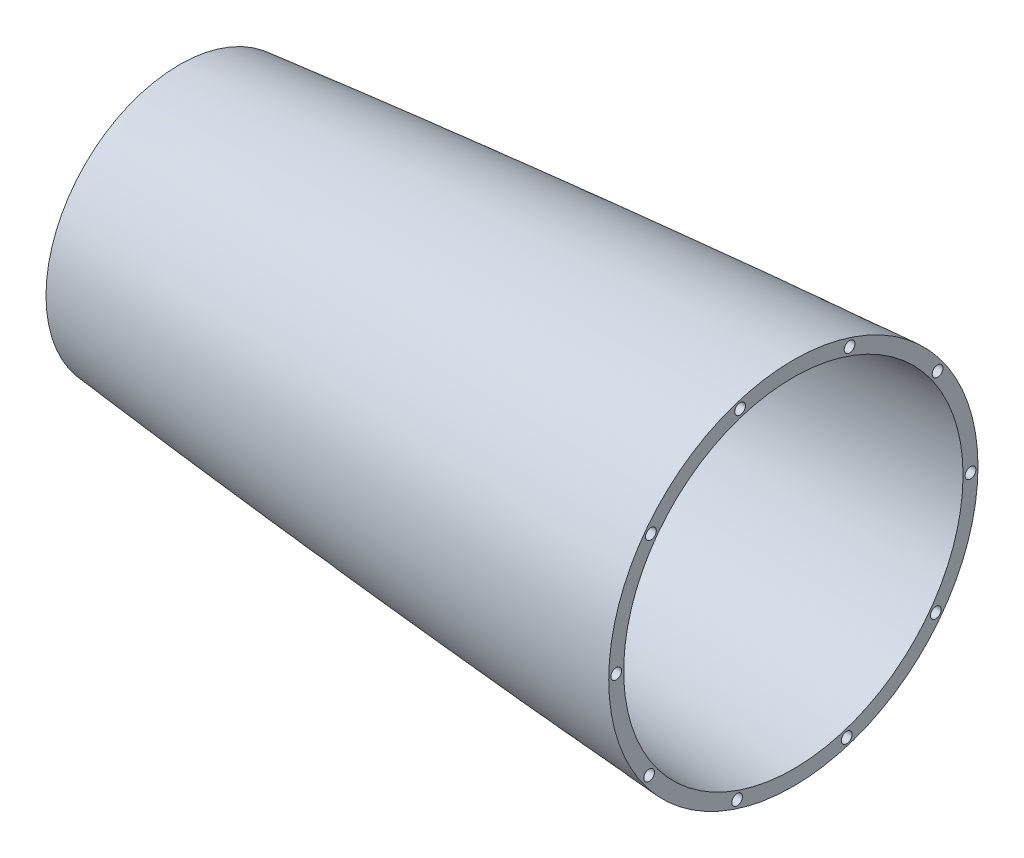
from build123d import *

# Parameters (mm, degrees)
SKETCH8_R          = 142.345864783
CUT_EXTRUDE4_DEPTH = 524.976683945
SKETCH9_R          = 2.286
CUT_EXTRUDE5_DEPTH = 10.16
SKETCH10_R         = 97.880426188
CUT_EXTRUDE6_DEPTH = 228.6


with BuildPart() as part:
    # Sketch1 → Revolve1 (revolve)
    with BuildSketch(Plane.XY):
        with BuildLine():
            Line((6.35, 11.460570284), (-259.812483715, 11.460570284))
            add(Edge.make_bspline(
                [(-259.812483715, 11.460570284), (-287.31210638, 10.562340852), (-342.298022137, 8.171569009), (-452.140135716, 1.833524736), (-589.280273052, -8.512118808), (-726.176632388, -21.770900754), (-835.465785428, -34.58872614), (-890.027026607, -41.965202762), (-917.245364413, -46.039623622)],
                knots=[0.121539178, 0.121539178, 0.121539178, 0.121539178, 0.200323508, 0.279107838, 0.436676499, 0.594245159, 0.67302949, 0.75181382, 0.75181382, 0.75181382, 0.75181382], degree=3))
            ThreePointArc((-917.245364413, -46.039623622), (-924.987260279, -50.310773033), (-928.0652, -58.599678629))
            Line((-928.0652, -58.599678629), (-921.7152, -58.599678629))
            ThreePointArc((-921.7152, -58.599678629), (-920.17623014, -54.455225831), (-916.305282206, -52.319651125))
            add(Edge.make_bspline(
                [(-259.605182082, 5.113954963), (-267.127682546, 4.868244998), (-283.42603151, 4.285669281), (-317.270262329, 2.880505646), (-361.130016616, 0.711244662), (-431.275457269, -3.371956494), (-501.372917975, -8.266876273), (-571.414486843, -13.891682648), (-623.914744737, -18.477698889), (-676.380314027, -23.439349795), (-728.80566324, -28.799062072), (-772.453634614, -33.627485173), (-807.34181653, -37.739154543), (-833.490683911, -40.958900147), (-859.619375692, -44.328941115), (-885.723877265, -47.869335132), (-904.612492975, -50.577906922), (-914.800968172, -52.094464395), (-916.305282206, -52.319651125)],
                knots=[0.121539178, 0.121539178, 0.121539178, 0.121539178, 0.143122913, 0.168303261, 0.218663957, 0.269024652, 0.369746043, 0.420106738, 0.470467434, 0.520828129, 0.571188825, 0.62154952, 0.646729868, 0.671910216, 0.697090564, 0.722270911, 0.747451259, 0.75181382, 0.75181382, 0.75181382, 0.75181382], degree=3))
            ThreePointArc((-259.605182082, 5.113954963), (-256.399753184, 4.364993874), (-254, 2.11179575))
            ThreePointArc((-254, 2.11179575), (-251.60858665, -0.136927523), (-248.413737762, -0.890953221))
            add(Edge.make_bspline(
                [(0, 0), (-50.8, 0), (-101.6, 0), (-157.182375328, 0), (-166.747125983, 0), (-181.094251966, 0), (-190.659002621, 0), (-199.585120865, 0), (-207.872606698, 0), (-220.304800851, -0.154959839), (-228.589711976, -0.361524821), (-235.094659099, -0.523710542), (-239.819642219, -0.641517002), (-245.046645359, -0.791480258), (-247.911294959, -0.876040976), (-248.413737762, -0.890953221)],
                knots=[0.761574077, 0.761574077, 0.761574077, 0.761574077, 0.907841521, 0.907841521, 0.921611321, 0.935381121, 0.94915092, 0.94915092, 0.961081918, 0.973012916, 0.984943914, 0.984943914, 0.991748303, 0.998552693, 1, 1, 1, 1], degree=3))
            Line((0, 0), (6.35, 0))
            Line((6.35, 0), (6.35, 11.460570284))
        make_face()
    revolve(axis=Axis((0, -76.2, 0), (-1, 0, 0)))

    # Sketch8 → Cut-Extrude4 (cut, through all)
    with BuildSketch(Plane(origin=(-438.15, 0, 0), x_dir=(0, 0, -1), z_dir=(1, 0, 0))):
        with Locations((0, -76.2)):
            Circle(SKETCH8_R)
    extrude(amount=CUT_EXTRUDE4_DEPTH, mode=Mode.SUBTRACT)

    # Sketch9 → Cut-Extrude5 (cut)
    with BuildSketch(Plane(origin=(-438.15, 0, 0), x_dir=(0, 0, -1), z_dir=(1, 0, 0))):
        with Locations((23.926020811, -4.692661383)):
            Circle(SKETCH9_R)
        with Locations((61.387516514, -32.412710015)):
            Circle(SKETCH9_R)
        with Locations((75.401067393, -76.858015146)):
            Circle(SKETCH9_R)
        with Locations((60.613973316, -121.051980857)):
            Circle(SKETCH9_R)
        with Locations((22.674401626, -148.114014343)):
            Circle(SKETCH9_R)
        with Locations((-23.926020811, -147.707338617)):
            Circle(SKETCH9_R)
        with Locations((-61.387516514, -119.987289985)):
            Circle(SKETCH9_R)
        with Locations((-75.401067393, -75.541984854)):
            Circle(SKETCH9_R)
        with Locations((-60.613973316, -31.348019143)):
            Circle(SKETCH9_R)
        with Locations((-22.674401626, -4.285985657)):
            Circle(SKETCH9_R)
    extrude(amount=-CUT_EXTRUDE5_DEPTH, mode=Mode.SUBTRACT)

    # Sketch10 → Cut-Extrude6 (cut)
    with BuildSketch(Plane(origin=(-928.0652, 0, 0), x_dir=(0, 0, -1), z_dir=(1, 0, 0))):
        with Locations((0, -76.2)):
            Circle(SKETCH10_R)
    extrude(amount=CUT_EXTRUDE6_DEPTH, mode=Mode.SUBTRACT)


solid = part.part
